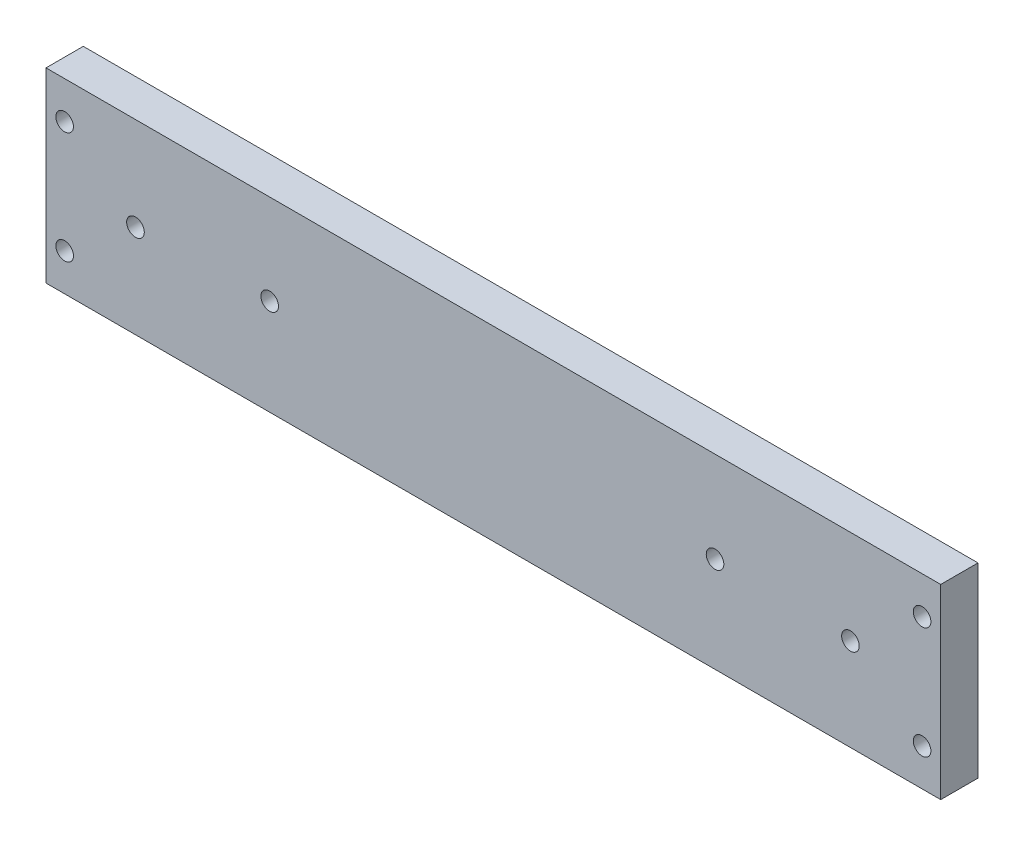
from build123d import *

# Parameters (mm, degrees)
SKETCH1_W                      = 152.4
SKETCH1_H                      = 6.35
WALL_DEPTH                     = 31.75
F_3_0MM_DOWEL_HOLE2_AT_2_COUNT = 2
F_3_0MM_DOWEL_HOLE2_AT_2_PITCH = 19.05
F_3_0MM_DOWEL_HOLE1_D          = 3
F_3_0MM_DOWEL_HOLE1_DEPTH      = 12.7
F_3_0MM_DOWEL_HOLE1_TIP        = 0.901290929
F_3_0MM_DOWEL_HOLE4_D          = 3
F_3_0MM_DOWEL_HOLE4_DEPTH      = 12.7
F_3_0MM_DOWEL_HOLE4_TIP        = 0.901290929
F_3_0MM_DOWEL_HOLE5_OUTLINE_R  = 1.5
F_3_0MM_DOWEL_HOLE5_DEPTH      = 6.35


# Read off the part's stored shape, not the designer's step: Ø3.0mm Dowel Hole5, Ø3.0mm Dowel Hole6
with BuildPart() as part:
    # Sketch1 → wall (new body)
    with BuildSketch(Plane(origin=(0, 0, 0), x_dir=(1, 0, 0), z_dir=(0, 1, 0))):
        with Locations((0, -3.175)):
            Rectangle(SKETCH1_W, SKETCH1_H)
    extrude(amount=WALL_DEPTH)

    # Sketch5 → Ø3.0mm Dowel Hole2 (revolve, cut)
    with BuildSketch(Plane(origin=(-73.025, 25.4, 0), x_dir=(0, 1, 0), z_dir=(1, 0, 0))):
        Polygon((0, 0), (0, 15.901286329), (1.5, 14.9999954), (1.5, 0), align=None)
    f_3_0mm_dowel_hole2 = revolve(axis=Axis((-73.025, 25.4, -6.35), (0, 0, 1)), mode=Mode.SUBTRACT)

    # Ø3.0mm Dowel Hole2 at 2: Ø3.0mm Dowel Hole2 ×2
    with Locations(*[(0, -i * F_3_0MM_DOWEL_HOLE2_AT_2_PITCH, 0) for i in range(1, F_3_0MM_DOWEL_HOLE2_AT_2_COUNT)]):
        add(f_3_0mm_dowel_hole2, mode=Mode.SUBTRACT)

    # Mirror1: Ø3.0mm Dowel Hole2 across plane
    add(f_3_0mm_dowel_hole2.mirror(Plane(origin=(0, 0, 0), x_dir=(0, 0, 1), z_dir=(1, 0, 0))), mode=Mode.SUBTRACT)

    # Mirror1 copy 1 sketch → Mirror1 copy 1 (revolve, cut)
    with BuildSketch(Plane(origin=(73.025, 6.35, 0), x_dir=(0, 1, 0), z_dir=(-1, 0, 0))):
        Polygon((0, 0), (0, -15.901286329), (1.5, -14.9999954), (1.5, 0), align=None)
    revolve(axis=Axis((73.025, 6.35, -6.35), (0, 0, -1)), mode=Mode.SUBTRACT)

    # Ø3.0mm Dowel Hole1
    with Locations(Plane(origin=(76.2, 31.75, -2.54), x_dir=(1, 0, 0), z_dir=(0, 0, -1))):
        with Locations((-137.16, 15.875)):
            Hole(F_3_0MM_DOWEL_HOLE1_D / 2, depth=F_3_0MM_DOWEL_HOLE1_DEPTH)
            with Locations((0, 0, -(F_3_0MM_DOWEL_HOLE1_DEPTH + F_3_0MM_DOWEL_HOLE1_TIP / 2))):  # 118° drill point
                Cone(0, F_3_0MM_DOWEL_HOLE1_D / 2, F_3_0MM_DOWEL_HOLE1_TIP, mode=Mode.SUBTRACT)

    # Ø3.0mm Dowel Hole4
    with Locations(Plane(origin=(76.2, 31.75, -2.54), x_dir=(1, 0, 0), z_dir=(0, 0, -1))):
        with Locations((-38.439194916, 15.502033877), (-15.376273346, 16.029273481)):
            Hole(F_3_0MM_DOWEL_HOLE4_D / 2, depth=F_3_0MM_DOWEL_HOLE4_DEPTH)
            with Locations((0, 0, -(F_3_0MM_DOWEL_HOLE4_DEPTH + F_3_0MM_DOWEL_HOLE4_TIP / 2))):  # 118° drill point
                Cone(0, F_3_0MM_DOWEL_HOLE4_D / 2, F_3_0MM_DOWEL_HOLE4_TIP, mode=Mode.SUBTRACT)

    # Ø3.0mm Dowel Hole5 outline → Ø3.0mm Dowel Hole5 (cut)
    with BuildSketch(Plane.XY):
        with Locations((-38.1, 16.386133576)):
            Circle(F_3_0MM_DOWEL_HOLE5_OUTLINE_R)
    extrude(amount=F_3_0MM_DOWEL_HOLE5_DEPTH, mode=Mode.SUBTRACT)

    # Ø3.0mm Dowel Hole6 outline → Ø3.0mm Dowel Hole6 (revolve, cut)
    with BuildSketch(Plane(origin=(-43.247895679, 16.386133576, 0), x_dir=(1, 0, 0), z_dir=(0, -1, 0))):
        Polygon((1.5, 0.186037407), (0, 1.087328336), (0, 0), (1.5, 0), align=None)
    revolve(axis=Axis((-43.247895679, 16.386133576, 0), (0, 0, 1)), mode=Mode.SUBTRACT)


solid = part.part
